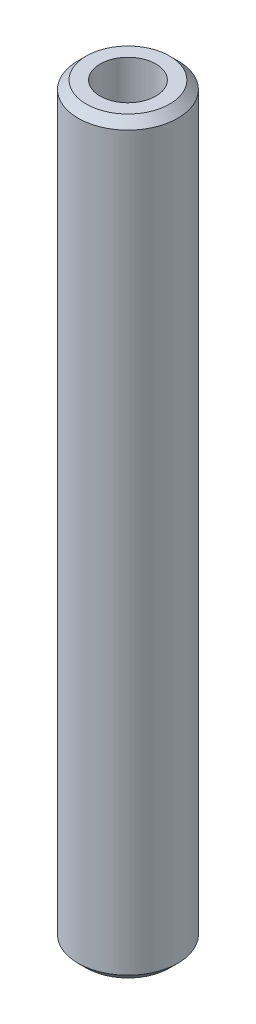
from build123d import *

# Parameters (mm, degrees)
SKETCH1_R           = 35
BOSS_EXTRUDE1_DEPTH = 525.271099313
SKETCH2_R           = 19.574792696
CUT_EXTRUDE1_DEPTH  = 528.59807408
CHAMFER1_SIZE       = 5.73642111


with BuildPart() as part:
    # Sketch1 → Boss-Extrude1 (new body)
    with BuildSketch(Plane(origin=(0, 0, 0), x_dir=(1, 0, 0), z_dir=(0, 1, 0))):
        Circle(SKETCH1_R)
    extrude(amount=BOSS_EXTRUDE1_DEPTH)

    # Sketch2 → Cut-Extrude1 (cut, through all)
    with BuildSketch(Plane(origin=(0, 0, 0), x_dir=(1, 0, 0), z_dir=(0, 1, 0))):
        Circle(SKETCH2_R)
    extrude(amount=CUT_EXTRUDE1_DEPTH, mode=Mode.SUBTRACT)

    # Chamfer1
    chamfer1_edges = [part.edges().sort_by_distance(p)[0] for p in [
        (-35, 525.271099313, 0),
        (-35, 0, 0),
    ]]
    chamfer(chamfer1_edges, length=CHAMFER1_SIZE)


solid = part.part
